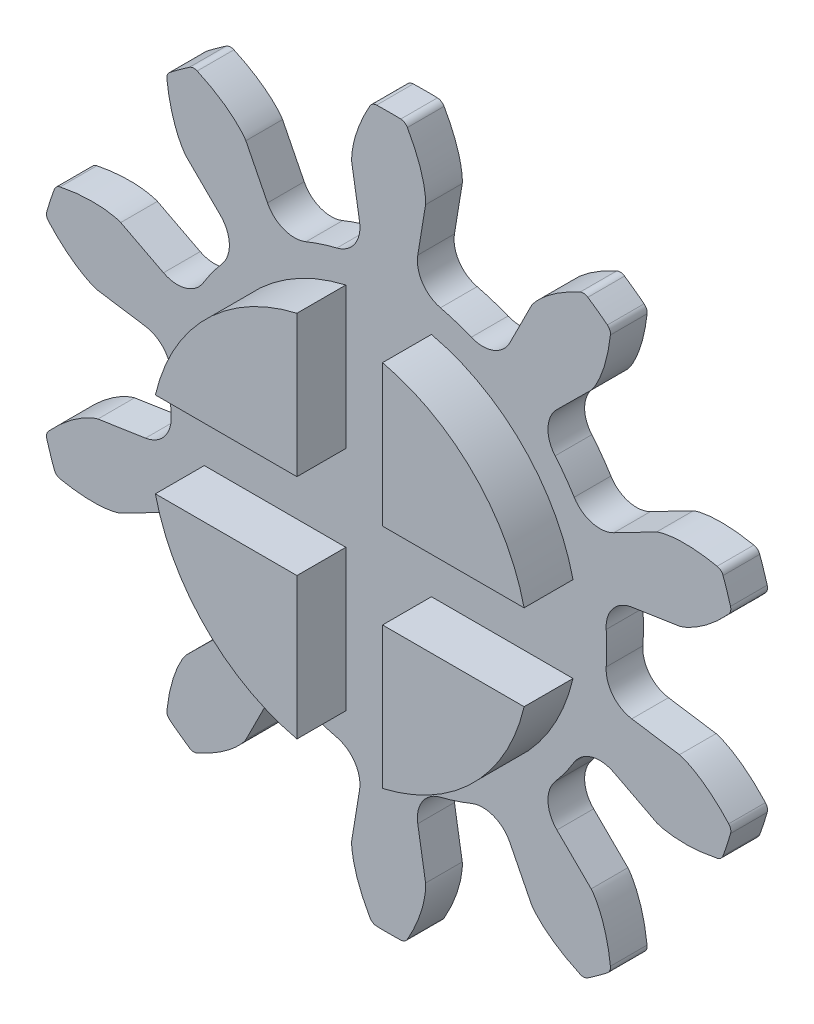
from build123d import *

# Parameters (mm, degrees)
SKETCH1_R                = 38.1
BOSS_EXTRUDE1_DEPTH      = 3.81
CUT_EXTRUDE1_DEPTH       = 12.7
FILLET1_R                = 1.984978256
CIRPATTERN1_COUNT        = 10
FILLET1_OF_CIRPATTERN1_R = 1.984978256
SKETCH5_OUTSIDE_W        = 96.554
SKETCH5_OUTSIDE_H        = 99.372
CUT_EXTRUDE2_DEPTH       = 54.03186954
BOSS_EXTRUDE2_DEPTH      = 5.08


with BuildPart() as part:
    # Sketch1 → Boss-Extrude1 (new body)
    with BuildSketch(Plane.XY):
        Circle(SKETCH1_R)
    extrude(amount=BOSS_EXTRUDE1_DEPTH)

    # Sketch2 → Cut-Extrude1 (cut)
    with BuildSketch(Plane.XY):
        with BuildLine():
            Line((30.386439354, -4.640174313), (23.539622021, -3.594628122))
            ThreePointArc((23.539622021, -3.594628122), (23.8125, 0), (23.539622021, 3.594628122))
            Line((23.539622021, 3.594628122), (30.386439354, 4.640174313))
            add(Edge.make_bspline(
                [(30.386439354, 4.640174313), (30.398458977, 4.642200808), (30.432071827, 4.648461005), (30.495211429, 4.66256966), (30.597567363, 4.688802053), (30.726926434, 4.72692779), (30.892775009, 4.781570835), (31.086286082, 4.852803502), (31.296840133, 4.938226004), (31.523474997, 5.038808293), (31.747294125, 5.145869285), (31.968324083, 5.258869133), (32.186408225, 5.376998004), (32.447977454, 5.52660472), (32.757928875, 5.715021098), (33.114509755, 5.948226262), (33.511947564, 6.227905073), (33.90910465, 6.528913991), (34.293272065, 6.838148467), (34.673383229, 7.165292217), (35.035433543, 7.492225839), (35.402771162, 7.846499599), (35.737439258, 8.181019533), (36.102292567, 8.57168722), (36.393820934, 8.891633915), (36.686262987, 9.235121657), (36.827298084, 9.404201552), (36.898823496, 9.491407936)],
                knots=[0, 0, 0, 0, 0, 0.005376749, 0.015083688, 0.02853182, 0.046610139, 0.064854849, 0.092110525, 0.119476176, 0.146842496, 0.174208854, 0.201574956, 0.228941013, 0.256307345, 0.307035032, 0.361767352, 0.416499661, 0.471231937, 0.525964282, 0.580696615, 0.635428982, 0.690161387, 0.744893688, 0.799626082, 0.854358408, 0.909090915, 0.909090915, 0.909090915, 0.909090915, 0.909090915], degree=4))
            ThreePointArc((36.898823496, 9.491407936), (63.437865226, 0), (36.898823496, -9.491407936))
            add(Edge.make_bspline(
                [(30.386439354, -4.640174313), (30.398458977, -4.642200808), (30.432071827, -4.648461005), (30.495211429, -4.66256966), (30.597567363, -4.688802053), (30.726926434, -4.72692779), (30.892775009, -4.781570835), (31.086286082, -4.852803502), (31.296840133, -4.938226004), (31.523474997, -5.038808293), (31.747294125, -5.145869285), (31.968324083, -5.258869133), (32.186408225, -5.376998004), (32.447977454, -5.52660472), (32.757928875, -5.715021098), (33.114509755, -5.948226262), (33.511947564, -6.227905073), (33.90910465, -6.528913991), (34.293272065, -6.838148467), (34.673383229, -7.165292217), (35.035433543, -7.492225839), (35.402771162, -7.846499599), (35.737439258, -8.181019533), (36.102292567, -8.57168722), (36.393820934, -8.891633915), (36.686262987, -9.235121657), (36.827298084, -9.404201552), (36.898823496, -9.491407936)],
                knots=[0, 0, 0, 0, 0, 0.005376749, 0.015083688, 0.02853182, 0.046610139, 0.064854849, 0.092110525, 0.119476176, 0.146842496, 0.174208854, 0.201574956, 0.228941013, 0.256307345, 0.307035032, 0.361767352, 0.416499661, 0.471231937, 0.525964282, 0.580696615, 0.635428982, 0.690161387, 0.744893688, 0.799626082, 0.854358408, 0.909090915, 0.909090915, 0.909090915, 0.909090915, 0.909090915], degree=4))
        make_face()
    cut_extrude1 = extrude(amount=CUT_EXTRUDE1_DEPTH, mode=Mode.SUBTRACT)

    # Fillet1
    fillet1_edges = [part.edges().sort_by_distance(p)[0] for p in [
        (36.898823496, -9.491407936, 1.905),
        (23.539622021, -3.594628122, 1.905),
        (23.539622021, 3.594628122, 1.905),
        (36.898823496, 9.491407936, 1.905),
    ]]
    fillet(fillet1_edges, radius=FILLET1_R)

    # CirPattern1: Cut-Extrude1 ×10 about axis
    cirpattern1_axis = Axis((0, 0, 3.81), (0, 0, -1))
    for i in range(1, CIRPATTERN1_COUNT):
        add(cut_extrude1.rotate(cirpattern1_axis, i * 360 / CIRPATTERN1_COUNT), mode=Mode.SUBTRACT)

    # Fillet1 of CirPattern1
    fillet1_of_cirpattern1_edges = [part.edges().sort_by_distance(p)[0] for p in [
        (24.272865672, -29.367294599, 1.905),
        (16.931084859, -16.744357908, 1.905),
        (21.156823654, -10.928127429, 1.905),
        (35.430684889, -14.009873957, 1.905),
        (2.375498166, -38.025872882, 1.905),
        (3.855448746, -23.498312093, 1.905),
        (10.692837745, -21.276709736, 1.905),
        (20.429228899, -32.159860176, 1.905),
        (-20.429228899, -32.159860176, 1.905),
        (-10.692837745, -21.276709736, 1.905),
        (-3.855448746, -23.498312093, 1.905),
        (-2.375498166, -38.025872882, 1.905),
        (-35.430684889, -14.009873957, 1.905),
        (-21.156823654, -10.928127429, 1.905),
        (-16.931084859, -16.744357908, 1.905),
        (-24.272865672, -29.367294599, 1.905),
        (-36.898823496, 9.491407936, 1.905),
        (-23.539622021, 3.594628122, 1.905),
        (-23.539622021, -3.594628122, 1.905),
        (-36.898823496, -9.491407936, 1.905),
        (-24.272865672, 29.367294599, 1.905),
        (-16.931084859, 16.744357908, 1.905),
        (-21.156823654, 10.928127429, 1.905),
        (-35.430684889, 14.009873957, 1.905),
        (-2.375498166, 38.025872882, 1.905),
        (-3.855448746, 23.498312093, 1.905),
        (-10.692837745, 21.276709736, 1.905),
        (-20.429228899, 32.159860176, 1.905),
        (20.429228899, 32.159860176, 1.905),
        (10.692837745, 21.276709736, 1.905),
        (3.855448746, 23.498312093, 1.905),
        (2.375498166, 38.025872882, 1.905),
        (35.430684889, 14.009873957, 1.905),
        (21.156823654, 10.928127429, 1.905),
        (16.931084859, 16.744357908, 1.905),
        (24.272865672, 29.367294599, 1.905),
    ]]
    fillet(fillet1_of_cirpattern1_edges, radius=FILLET1_OF_CIRPATTERN1_R)

    # Sketch5 outside → Cut-Extrude2 (cut, through all)
    with BuildSketch(Plane.XY):
        Rectangle(SKETCH5_OUTSIDE_W, SKETCH5_OUTSIDE_H)
        with BuildLine():
            Line((25.251699955, 5.025776083), (30.196004145, 5.780798184))
            add(Edge.make_bspline(
                [(30.196004145, 5.780798184), (30.261079792, 5.794388168), (30.32481052, 5.8136517), (30.451564765, 5.853522369), (30.514420702, 5.875175667), (30.701309384, 5.943686711), (30.82392104, 5.994096514), (31.187525813, 6.155439648), (31.424303804, 6.276465414), (32.116900204, 6.665378078), (32.558818073, 6.960621046), (33.829072115, 7.916027854), (34.602776534, 8.64619941), (35.318163879, 9.429307763)],
                knots=[0, 0, 0, 0, 0.03125, 0.03125, 0.0625, 0.0625, 0.125, 0.125, 0.25, 0.25, 0.5, 0.5, 1, 1, 1, 1], degree=3))
            ThreePointArc((35.318163879, 9.429307763), (35.51319763, 9.799293316), (35.502698394, 10.217404832))
            ThreePointArc((35.502698394, 10.217404832), (35.135546429, 11.416231073), (34.727926224, 12.601908385))
            ThreePointArc((34.727926224, 12.601908385), (34.490660501, 12.946339003), (34.11540283, 13.13102564))
            add(Edge.make_bspline(
                [(34.11540283, 13.13102564), (33.075292612, 13.344294806), (32.024926343, 13.479903538), (30.431401295, 13.506373904), (29.900784468, 13.485522023), (29.109268608, 13.392602229), (28.847706619, 13.351396117), (28.460065678, 13.268452523), (28.331640288, 13.237261652), (28.140665777, 13.182998026), (28.077288807, 13.163646227), (27.951315148, 13.121435481), (27.88847748, 13.099659666), (27.826948435, 13.072001942)],
                knots=[0, 0, 0, 0, 0.5, 0.5, 0.75, 0.75, 0.875, 0.875, 0.9375, 0.9375, 0.96875, 0.96875, 1, 1, 1, 1], degree=3))
            Line((27.826948435, 13.072001942), (23.383131464, 10.776638568))
            ThreePointArc((23.383131464, 10.776638568), (21.103330779, 10.540202047), (19.269772564, 11.9155048))
            ThreePointArc((19.269772564, 11.9155048), (18.329250665, 13.316980114), (17.287005685, 14.644549284))
            ThreePointArc((17.287005685, 14.644549284), (16.545615688, 16.813358696), (17.474977338, 18.90851509))
            Line((17.474977338, 18.90851509), (21.031212596, 22.425529887))
            add(Edge.make_bspline(
                [(21.031212596, 22.425529887), (21.075871909, 22.474774921), (21.116108331, 22.527819427), (21.195219278, 22.634579751), (21.23334331, 22.68904343), (21.344269648, 22.854320441), (21.413834423, 22.967172151), (21.613161748, 23.311423012), (21.733582007, 23.548509524), (22.065307136, 24.270244428), (22.24928674, 24.768853813), (22.715369816, 26.288430749), (22.912125767, 27.333923995), (23.030586745, 28.387966091)],
                knots=[0, 0, 0, 0, 0.03125, 0.03125, 0.0625, 0.0625, 0.125, 0.125, 0.25, 0.25, 0.5, 0.5, 1, 1, 1, 1], degree=3))
            ThreePointArc((23.030586745, 28.387966091), (22.970900313, 28.801928654), (22.71664647, 29.13401668))
            ThreePointArc((22.71664647, 29.13401668), (21.714961906, 29.888080972), (20.688266595, 30.607720922))
            ThreePointArc((20.688266595, 30.607720922), (20.293863356, 30.746909853), (19.881717441, 30.675753556))
            add(Edge.make_bspline(
                [(19.881717441, 30.675753556), (18.914894128, 30.236930488), (17.985421154, 29.729250455), (16.680673417, 28.814014908), (16.263651815, 28.485256637), (15.677918918, 27.944841595), (15.490531168, 27.757762871), (15.22567608, 27.462810465), (15.140111291, 27.36208997), (15.017505025, 27.205937773), (14.977606682, 27.153029791), (14.900502705, 27.044835121), (14.862465467, 26.990283062), (14.828944226, 26.931741628)],
                knots=[0, 0, 0, 0, 0.5, 0.5, 0.75, 0.75, 0.875, 0.875, 0.9375, 0.9375, 0.96875, 0.96875, 1, 1, 1, 1], degree=3))
            Line((14.828944226, 26.931741628), (12.583001516, 22.462743571))
            ThreePointArc((12.583001516, 22.462743571), (10.877577919, 20.931429186), (8.585815487, 20.966334007))
            ThreePointArc((8.585815487, 20.966334007), (7.001150766, 21.547326452), (5.377631285, 22.008736244))
            ThreePointArc((5.377631285, 22.008736244), (3.503039991, 23.327561809), (3.02340733, 25.56884401))
            Line((3.02340733, 25.56884401), (3.83321266, 30.504471388))
            add(Edge.make_bspline(
                [(3.83321266, 30.504471388), (3.840397298, 30.570561543), (3.841770469, 30.637125826), (3.843020426, 30.76999699), (3.841850468, 30.836467775), (3.834444372, 31.035380552), (3.824390886, 31.167568652), (3.7833045, 31.56323511), (3.741370581, 31.82582338), (3.585516715, 32.604702322), (3.441284098, 33.116226286), (2.925168314, 34.61954661), (2.469821712, 35.581018659), (1.946108256, 36.503386244)],
                knots=[0, 0, 0, 0, 0.03125, 0.03125, 0.0625, 0.0625, 0.125, 0.125, 0.25, 0.25, 0.5, 0.5, 1, 1, 1, 1], degree=3))
            ThreePointArc((1.946108256, 36.503386244), (1.654499829, 36.803206188), (1.253607705, 36.922424385))
            ThreePointArc((1.253607705, 36.922424385), (0, 36.943699798), (-1.253607705, 36.922424385))
            ThreePointArc((-1.253607705, 36.922424385), (-1.654499829, 36.803206188), (-1.946108256, 36.503386244))
            add(Edge.make_bspline(
                [(-1.946108256, 36.503386244), (-2.470351019, 35.580086439), (-2.923903615, 34.623034158), (-3.44150475, 33.11568157), (-3.58564305, 32.604591394), (-3.741862927, 31.823101282), (-3.783500685, 31.561607659), (-3.824404278, 31.167308236), (-3.834425625, 31.035529922), (-3.841832219, 30.837133987), (-3.843012125, 30.770878872), (-3.841795322, 30.638026965), (-3.840503198, 30.571535695), (-3.83321266, 30.504471388)],
                knots=[0, 0, 0, 0, 0.5, 0.5, 0.75, 0.75, 0.875, 0.875, 0.9375, 0.9375, 0.96875, 0.96875, 1, 1, 1, 1], degree=3))
            Line((-3.83321266, 30.504471388), (-3.02340733, 25.56884401))
            ThreePointArc((-3.02340733, 25.56884401), (-3.503039991, 23.327561809), (-5.377631285, 22.008736244))
            ThreePointArc((-5.377631285, 22.008736244), (-7.001150766, 21.547326452), (-8.585815487, 20.966334007))
            ThreePointArc((-8.585815487, 20.966334007), (-10.877577919, 20.931429186), (-12.583001516, 22.462743571))
            Line((-12.583001516, 22.462743571), (-14.828944226, 26.931741628))
            add(Edge.make_bspline(
                [(-14.828944226, 26.931741628), (-14.86197855, 26.98943271), (-14.899993135, 27.044091476), (-14.97708161, 27.152321212), (-15.017098672, 27.205409524), (-15.140008327, 27.361980146), (-15.225839984, 27.463013274), (-15.491646477, 27.758964192), (-15.679917243, 27.946754426), (-16.263819224, 28.485272122), (-16.681172104, 28.814325897), (-17.982348061, 29.72717234), (-18.915870291, 30.237373551), (-19.881717441, 30.675753556)],
                knots=[0, 0, 0, 0, 0.03125, 0.03125, 0.0625, 0.0625, 0.125, 0.125, 0.25, 0.25, 0.5, 0.5, 1, 1, 1, 1], degree=3))
            ThreePointArc((-19.881717441, 30.675753556), (-20.293863356, 30.746909853), (-20.688266595, 30.607720922))
            ThreePointArc((-20.688266595, 30.607720922), (-21.714961906, 29.888080972), (-22.71664647, 29.13401668))
            ThreePointArc((-22.71664647, 29.13401668), (-22.970900313, 28.801928654), (-23.030586745, 28.387966091))
            add(Edge.make_bspline(
                [(-23.030586745, 28.387966091), (-22.912006041, 27.332858694), (-22.716396582, 26.291995607), (-22.249145076, 24.768283433), (-22.065344141, 24.270080428), (-21.732380314, 23.546017907), (-21.612363873, 23.309991061), (-21.413692189, 22.966953598), (-21.34434228, 22.854452303), (-21.233720135, 22.689593133), (-21.19573092, 22.635298088), (-21.116658114, 22.528533856), (-21.076530175, 22.47550078), (-21.031212596, 22.425529887)],
                knots=[0, 0, 0, 0, 0.5, 0.5, 0.75, 0.75, 0.875, 0.875, 0.9375, 0.9375, 0.96875, 0.96875, 1, 1, 1, 1], degree=3))
            Line((-21.031212596, 22.425529887), (-17.474977338, 18.90851509))
            ThreePointArc((-17.474977338, 18.90851509), (-16.545615688, 16.813358696), (-17.287005685, 14.644549284))
            ThreePointArc((-17.287005685, 14.644549284), (-18.329250665, 13.316980114), (-19.269772564, 11.9155048))
            ThreePointArc((-19.269772564, 11.9155048), (-21.103330779, 10.540202047), (-23.383131464, 10.776638568))
            Line((-23.383131464, 10.776638568), (-27.826948435, 13.072001942))
            add(Edge.make_bspline(
                [(-27.826948435, 13.072001942), (-27.887583732, 13.09925792), (-27.950465793, 13.121133378), (-28.076447522, 13.163381605), (-28.140026533, 13.182809512), (-28.331492434, 13.237233324), (-28.460317487, 13.26852026), (-28.849315042, 13.351712445), (-29.112009621, 13.392975156), (-29.900929007, 13.48543615), (-30.431987535, 13.506332378), (-32.021218674, 13.480028626), (-33.07634277, 13.344079476), (-34.11540283, 13.13102564)],
                knots=[0, 0, 0, 0, 0.03125, 0.03125, 0.0625, 0.0625, 0.125, 0.125, 0.25, 0.25, 0.5, 0.5, 1, 1, 1, 1], degree=3))
            ThreePointArc((-34.11540283, 13.13102564), (-34.490660501, 12.946339003), (-34.727926224, 12.601908385))
            ThreePointArc((-34.727926224, 12.601908385), (-35.135546429, 11.416231073), (-35.502698394, 10.217404832))
            ThreePointArc((-35.502698394, 10.217404832), (-35.51319763, 9.799293316), (-35.318163879, 9.429307763))
            add(Edge.make_bspline(
                [(-35.318163879, 9.429307763), (-34.602053506, 8.645407937), (-33.831998157, 7.918308366), (-32.558368203, 6.960242867), (-32.116833744, 6.665223648), (-31.421867078, 6.275155991), (-31.186038639, 6.154750155), (-30.823677508, 5.994003304), (-30.701445651, 5.943750699), (-30.515048667, 5.875398893), (-30.45240092, 5.85380278), (-30.325675235, 5.813906531), (-30.262038991, 5.794588481), (-30.196004145, 5.780798184)],
                knots=[0, 0, 0, 0, 0.5, 0.5, 0.75, 0.75, 0.875, 0.875, 0.9375, 0.9375, 0.96875, 0.96875, 1, 1, 1, 1], degree=3))
            Line((-30.196004145, 5.780798184), (-25.251699955, 5.025776083))
            ThreePointArc((-25.251699955, 5.025776083), (-23.268328557, 3.877024026), (-22.593331477, 1.686642248))
            ThreePointArc((-22.593331477, 1.686642248), (-22.656199798, 0), (-22.593331477, -1.686642248))
            ThreePointArc((-22.593331477, -1.686642248), (-23.268328557, -3.877024026), (-25.251699955, -5.025776083))
            Line((-25.251699955, -5.025776083), (-30.196004145, -5.780798184))
            add(Edge.make_bspline(
                [(-30.196004145, -5.780798184), (-30.261079792, -5.794388168), (-30.32481052, -5.8136517), (-30.451564765, -5.853522369), (-30.514420702, -5.875175667), (-30.701309384, -5.943686711), (-30.82392104, -5.994096514), (-31.187525813, -6.155439648), (-31.424303804, -6.276465414), (-32.116900204, -6.665378078), (-32.558818073, -6.960621046), (-33.829072115, -7.916027854), (-34.602776534, -8.64619941), (-35.318163879, -9.429307763)],
                knots=[0, 0, 0, 0, 0.03125, 0.03125, 0.0625, 0.0625, 0.125, 0.125, 0.25, 0.25, 0.5, 0.5, 1, 1, 1, 1], degree=3))
            ThreePointArc((-35.318163879, -9.429307763), (-35.51319763, -9.799293316), (-35.502698394, -10.217404832))
            ThreePointArc((-35.502698394, -10.217404832), (-35.135546429, -11.416231073), (-34.727926224, -12.601908385))
            ThreePointArc((-34.727926224, -12.601908385), (-34.490660501, -12.946339003), (-34.11540283, -13.13102564))
            add(Edge.make_bspline(
                [(-34.11540283, -13.13102564), (-33.075292612, -13.344294806), (-32.024926343, -13.479903538), (-30.431401295, -13.506373904), (-29.900784468, -13.485522023), (-29.109268608, -13.392602229), (-28.847706619, -13.351396117), (-28.460065678, -13.268452523), (-28.331640288, -13.237261652), (-28.140665777, -13.182998026), (-28.077288807, -13.163646227), (-27.951315148, -13.121435481), (-27.88847748, -13.099659666), (-27.826948435, -13.072001942)],
                knots=[0, 0, 0, 0, 0.5, 0.5, 0.75, 0.75, 0.875, 0.875, 0.9375, 0.9375, 0.96875, 0.96875, 1, 1, 1, 1], degree=3))
            Line((-27.826948435, -13.072001942), (-23.383131464, -10.776638568))
            ThreePointArc((-23.383131464, -10.776638568), (-21.103330779, -10.540202047), (-19.269772564, -11.9155048))
            ThreePointArc((-19.269772564, -11.9155048), (-18.329250665, -13.316980114), (-17.287005685, -14.644549284))
            ThreePointArc((-17.287005685, -14.644549284), (-16.545615688, -16.813358696), (-17.474977338, -18.90851509))
            Line((-17.474977338, -18.90851509), (-21.031212596, -22.425529887))
            add(Edge.make_bspline(
                [(-21.031212596, -22.425529887), (-21.075871909, -22.474774921), (-21.116108331, -22.527819427), (-21.195219278, -22.634579751), (-21.23334331, -22.68904343), (-21.344269648, -22.854320441), (-21.413834423, -22.967172151), (-21.613161748, -23.311423012), (-21.733582007, -23.548509524), (-22.065307136, -24.270244428), (-22.24928674, -24.768853813), (-22.715369816, -26.288430749), (-22.912125767, -27.333923995), (-23.030586745, -28.387966091)],
                knots=[0, 0, 0, 0, 0.03125, 0.03125, 0.0625, 0.0625, 0.125, 0.125, 0.25, 0.25, 0.5, 0.5, 1, 1, 1, 1], degree=3))
            ThreePointArc((-23.030586745, -28.387966091), (-22.970900313, -28.801928654), (-22.71664647, -29.13401668))
            ThreePointArc((-22.71664647, -29.13401668), (-21.714961906, -29.888080972), (-20.688266595, -30.607720922))
            ThreePointArc((-20.688266595, -30.607720922), (-20.293863356, -30.746909853), (-19.881717441, -30.675753556))
            add(Edge.make_bspline(
                [(-19.881717441, -30.675753556), (-18.914894128, -30.236930488), (-17.985421154, -29.729250455), (-16.680673417, -28.814014908), (-16.263651815, -28.485256637), (-15.677918918, -27.944841595), (-15.490531168, -27.757762871), (-15.22567608, -27.462810465), (-15.140111291, -27.36208997), (-15.017505025, -27.205937773), (-14.977606682, -27.153029791), (-14.900502705, -27.044835121), (-14.862465467, -26.990283062), (-14.828944226, -26.931741628)],
                knots=[0, 0, 0, 0, 0.5, 0.5, 0.75, 0.75, 0.875, 0.875, 0.9375, 0.9375, 0.96875, 0.96875, 1, 1, 1, 1], degree=3))
            Line((-14.828944226, -26.931741628), (-12.583001516, -22.462743571))
            ThreePointArc((-12.583001516, -22.462743571), (-10.877577919, -20.931429186), (-8.585815487, -20.966334007))
            ThreePointArc((-8.585815487, -20.966334007), (-7.001150766, -21.547326452), (-5.377631285, -22.008736244))
            ThreePointArc((-5.377631285, -22.008736244), (-3.503039991, -23.327561809), (-3.02340733, -25.56884401))
            Line((-3.02340733, -25.56884401), (-3.83321266, -30.504471388))
            add(Edge.make_bspline(
                [(-3.83321266, -30.504471388), (-3.840397298, -30.570561543), (-3.841770469, -30.637125826), (-3.843020426, -30.76999699), (-3.841850468, -30.836467775), (-3.834444372, -31.035380552), (-3.824390886, -31.167568652), (-3.7833045, -31.56323511), (-3.741370581, -31.82582338), (-3.585516715, -32.604702322), (-3.441284098, -33.116226286), (-2.925168314, -34.61954661), (-2.469821712, -35.581018659), (-1.946108256, -36.503386244)],
                knots=[0, 0, 0, 0, 0.03125, 0.03125, 0.0625, 0.0625, 0.125, 0.125, 0.25, 0.25, 0.5, 0.5, 1, 1, 1, 1], degree=3))
            ThreePointArc((-1.946108256, -36.503386244), (-1.654499829, -36.803206188), (-1.253607705, -36.922424385))
            ThreePointArc((-1.253607705, -36.922424385), (0, -36.943699798), (1.253607705, -36.922424385))
            ThreePointArc((1.253607705, -36.922424385), (1.654499829, -36.803206188), (1.946108256, -36.503386244))
            add(Edge.make_bspline(
                [(1.946108256, -36.503386244), (2.470351019, -35.580086439), (2.923903615, -34.623034158), (3.44150475, -33.11568157), (3.58564305, -32.604591394), (3.741862927, -31.823101282), (3.783500685, -31.561607659), (3.824404278, -31.167308236), (3.834425625, -31.035529922), (3.841832219, -30.837133987), (3.843012125, -30.770878872), (3.841795322, -30.638026965), (3.840503198, -30.571535695), (3.83321266, -30.504471388)],
                knots=[0, 0, 0, 0, 0.5, 0.5, 0.75, 0.75, 0.875, 0.875, 0.9375, 0.9375, 0.96875, 0.96875, 1, 1, 1, 1], degree=3))
            Line((3.83321266, -30.504471388), (3.02340733, -25.56884401))
            ThreePointArc((3.02340733, -25.56884401), (3.503039991, -23.327561809), (5.377631285, -22.008736244))
            ThreePointArc((5.377631285, -22.008736244), (7.001150766, -21.547326452), (8.585815487, -20.966334007))
            ThreePointArc((8.585815487, -20.966334007), (10.877577919, -20.931429186), (12.583001516, -22.462743571))
            Line((12.583001516, -22.462743571), (14.828944226, -26.931741628))
            add(Edge.make_bspline(
                [(14.828944226, -26.931741628), (14.86197855, -26.98943271), (14.899993135, -27.044091476), (14.97708161, -27.152321212), (15.017098672, -27.205409524), (15.140008327, -27.361980146), (15.225839984, -27.463013274), (15.491646477, -27.758964192), (15.679917243, -27.946754426), (16.263819224, -28.485272122), (16.681172104, -28.814325897), (17.982348061, -29.72717234), (18.915870291, -30.237373551), (19.881717441, -30.675753556)],
                knots=[0, 0, 0, 0, 0.03125, 0.03125, 0.0625, 0.0625, 0.125, 0.125, 0.25, 0.25, 0.5, 0.5, 1, 1, 1, 1], degree=3))
            ThreePointArc((19.881717441, -30.675753556), (20.293863356, -30.746909853), (20.688266595, -30.607720922))
            ThreePointArc((20.688266595, -30.607720922), (21.714961906, -29.888080972), (22.71664647, -29.13401668))
            ThreePointArc((22.71664647, -29.13401668), (22.970900313, -28.801928654), (23.030586745, -28.387966091))
            add(Edge.make_bspline(
                [(23.030586745, -28.387966091), (22.912006041, -27.332858694), (22.716396582, -26.291995607), (22.249145076, -24.768283433), (22.065344141, -24.270080428), (21.732380314, -23.546017907), (21.612363873, -23.309991061), (21.413692189, -22.966953598), (21.34434228, -22.854452303), (21.233720135, -22.689593133), (21.19573092, -22.635298088), (21.116658114, -22.528533856), (21.076530175, -22.47550078), (21.031212596, -22.425529887)],
                knots=[0, 0, 0, 0, 0.5, 0.5, 0.75, 0.75, 0.875, 0.875, 0.9375, 0.9375, 0.96875, 0.96875, 1, 1, 1, 1], degree=3))
            Line((21.031212596, -22.425529887), (17.474977338, -18.90851509))
            ThreePointArc((17.474977338, -18.90851509), (16.545615688, -16.813358696), (17.287005685, -14.644549284))
            ThreePointArc((17.287005685, -14.644549284), (18.329250665, -13.316980114), (19.269772564, -11.9155048))
            ThreePointArc((19.269772564, -11.9155048), (21.103330779, -10.540202047), (23.383131464, -10.776638568))
            Line((23.383131464, -10.776638568), (27.826948435, -13.072001942))
            add(Edge.make_bspline(
                [(27.826948435, -13.072001942), (27.887583732, -13.09925792), (27.950465793, -13.121133378), (28.076447522, -13.163381605), (28.140026533, -13.182809512), (28.331492434, -13.237233324), (28.460317487, -13.26852026), (28.849315042, -13.351712445), (29.112009621, -13.392975156), (29.900929007, -13.48543615), (30.431987535, -13.506332378), (32.021218674, -13.480028626), (33.07634277, -13.344079476), (34.11540283, -13.13102564)],
                knots=[0, 0, 0, 0, 0.03125, 0.03125, 0.0625, 0.0625, 0.125, 0.125, 0.25, 0.25, 0.5, 0.5, 1, 1, 1, 1], degree=3))
            ThreePointArc((34.11540283, -13.13102564), (34.490660501, -12.946339003), (34.727926224, -12.601908385))
            ThreePointArc((34.727926224, -12.601908385), (35.135546429, -11.416231073), (35.502698394, -10.217404832))
            ThreePointArc((35.502698394, -10.217404832), (35.51319763, -9.799293316), (35.318163879, -9.429307763))
            add(Edge.make_bspline(
                [(35.318163879, -9.429307763), (34.602053506, -8.645407937), (33.831998157, -7.918308366), (32.558368203, -6.960242867), (32.116833744, -6.665223648), (31.421867078, -6.275155991), (31.186038639, -6.154750155), (30.823677508, -5.994003304), (30.701445651, -5.943750699), (30.515048667, -5.875398893), (30.45240092, -5.85380278), (30.325675235, -5.813906531), (30.262038991, -5.794588481), (30.196004145, -5.780798184)],
                knots=[0, 0, 0, 0, 0.5, 0.5, 0.75, 0.75, 0.875, 0.875, 0.9375, 0.9375, 0.96875, 0.96875, 1, 1, 1, 1], degree=3))
            Line((30.196004145, -5.780798184), (25.251699955, -5.025776083))
            ThreePointArc((25.251699955, -5.025776083), (23.268328557, -3.877024026), (22.593331477, -1.686642248))
            ThreePointArc((22.593331477, -1.686642248), (22.656199798, 0), (22.593331477, 1.686642248))
            ThreePointArc((22.593331477, 1.686642248), (23.268328557, 3.877024026), (25.251699955, 5.025776083))
        make_face(mode=Mode.SUBTRACT)
    extrude(amount=CUT_EXTRUDE2_DEPTH, mode=Mode.SUBTRACT)

    # Sketch8 → Boss-Extrude2 (add)
    with BuildSketch(Plane.XY.offset(3.81)):
        with BuildLine():
            Line((-4.445, -4.445), (-19.147014532, -4.445))
            ThreePointArc((-19.147014532, -4.445), (-13.89903217, -13.89903217), (-4.445, -19.147014532))
            Line((-4.445, -19.147014532), (-4.445, -4.445))
        make_face()
        with BuildLine():
            ThreePointArc((-4.445, 19.147014532), (-13.89903217, 13.89903217), (-19.147014532, 4.445))
            Line((-19.147014532, 4.445), (-4.445, 4.445))
            Line((-4.445, 4.445), (-4.445, 19.147014532))
        make_face()
        with BuildLine():
            Line((19.147014532, -4.445), (4.445, -4.445))
            Line((4.445, -4.445), (4.445, -19.147014532))
            ThreePointArc((4.445, -19.147014532), (13.89903217, -13.89903217), (19.147014532, -4.445))
        make_face()
        with BuildLine():
            Line((4.445, 19.147014532), (4.445, 4.445))
            Line((4.445, 4.445), (19.147014532, 4.445))
            ThreePointArc((19.147014532, 4.445), (13.89903217, 13.89903217), (4.445, 19.147014532))
        make_face()
    extrude(amount=BOSS_EXTRUDE2_DEPTH)


solid = part.part
